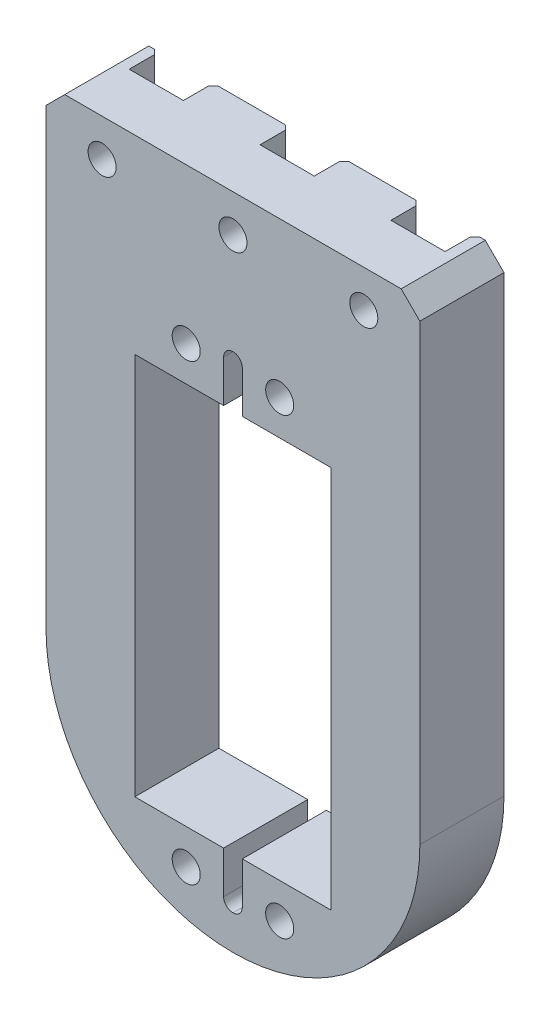
from build123d import *

# Parameters (mm, degrees)
SKETCH_1_W          = 40
SKETCH_1_H          = 70.5
EXTRUDE_1_DEPTH     = 9
CHAMFER_1_SIZE      = 2
FILLET_3_R          = 20
SKETCH_2_W          = 21
SKETCH_2_H          = 41
CUT_EXTRUDE_1_DEPTH = 10
SKETCH_3_W          = 2
SKETCH_3_H          = 5.5
CUT_EXTRUDE_2_DEPTH = 10
SKETCH_4_R          = 1.5
CUT_EXTRUDE_3_DEPTH = 10
SKETCH_5_R          = 1.5
CUT_EXTRUDE_4_DEPTH = 10
FILLET_4_R          = 1
CUT_EXTRUDE_5_DEPTH = 3.2
CHAMFER_2_SIZE      = 0.5


with BuildPart() as part:
    # 草图1 → 凸台-拉伸1 (new body)
    with BuildSketch(Plane.XY):
        with Locations((20, -34.75)):
            Rectangle(SKETCH_1_W, SKETCH_1_H)
    extrude(amount=EXTRUDE_1_DEPTH)

    # 倒角1
    chamfer_1_edges = [part.edges().sort_by_distance(p)[0] for p in [
        (0, 0.5, 4.5),
        (40, 0.5, 4.5),
    ]]
    chamfer(chamfer_1_edges, length=CHAMFER_1_SIZE)

    # 圆角3
    fillet_3_edges = [part.edges().sort_by_distance(p)[0] for p in [
        (0, -70, 4.5),
        (40, -70, 4.5),
    ]]
    fillet(fillet_3_edges, radius=FILLET_3_R - 0.0001)  # a hair under: the kernel refuses the full size

    # 草图2 → 切除-拉伸1 (cut)
    with BuildSketch(Plane(origin=(0, 0, 0), x_dir=(-1, 0, 0), z_dir=(0, 0, -1))):
        with Locations((-20, -40.32)):
            Rectangle(SKETCH_2_W, SKETCH_2_H)
    extrude(amount=-CUT_EXTRUDE_1_DEPTH, mode=Mode.SUBTRACT)

    # 草图3 → 切除-拉伸2 (cut)
    with BuildSketch(Plane.XY.offset(9)):
        with Locations((20, -17.07)):
            Rectangle(SKETCH_3_W, SKETCH_3_H)
        with Locations((20, -63.57)):
            Rectangle(SKETCH_3_W, SKETCH_3_H)
    extrude(amount=-CUT_EXTRUDE_2_DEPTH, mode=Mode.SUBTRACT)

    # 草图4 → 切除-拉伸3 (cut)
    with BuildSketch(Plane(origin=(0, 0, 0), x_dir=(-1, 0, 0), z_dir=(0, 0, -1))):
        with Locations((-25, -16.07)):
            Circle(SKETCH_4_R)
        with Locations((-15, -16.07)):
            Circle(SKETCH_4_R)
        with Locations((-25, -64.57)):
            Circle(SKETCH_4_R)
        with Locations((-15, -64.57)):
            Circle(SKETCH_4_R)
    extrude(amount=-CUT_EXTRUDE_3_DEPTH, mode=Mode.SUBTRACT)

    # 草图5 → 切除-拉伸4 (cut)
    with BuildSketch(Plane(origin=(0, 0, 0), x_dir=(-1, 0, 0), z_dir=(0, 0, -1))):
        with Locations((-34, -3.5)):
            Circle(SKETCH_5_R)
        with Locations((-20, -3.5)):
            Circle(SKETCH_5_R)
        with Locations((-6, -3.5)):
            Circle(SKETCH_5_R)
    extrude(amount=-CUT_EXTRUDE_4_DEPTH, mode=Mode.SUBTRACT)

    # 圆角4
    fillet_4_edges = [part.edges().sort_by_distance(p)[0] for p in [
        (21, -66.32, 4.5),
        (19, -66.32, 4.5),
        (21, -14.32, 4.5),
        (19, -14.32, 4.5),
    ]]
    fillet(fillet_4_edges, radius=FILLET_4_R - 0.0001)  # a hair under: the kernel refuses the full size

    # 草图7 → 切除-拉伸5 (cut)
    with BuildSketch(Plane(origin=(0, 0, 0), x_dir=(-1, 0, 0), z_dir=(0, 0, -1))):
        with BuildLine():
            Line((-36.9, -3.5), (-36.9, 0.5))
            Line((-36.9, 0.5), (-31.1, 0.5))
            Line((-31.1, 0.5), (-31.1, -3.5))
            ThreePointArc((-31.1, -3.5), (-34, -6.4), (-36.9, -3.5))
        make_face()
        with BuildLine():
            Line((-17.1, -3.5), (-17.1, 0.5))
            Line((-17.1, 0.5), (-22.9, 0.5))
            Line((-22.9, 0.5), (-22.9, -3.5))
            ThreePointArc((-22.9, -3.5), (-20, -6.4), (-17.1, -3.5))
        make_face()
        with BuildLine():
            Line((-3.1, -3.5), (-3.1, 0.5))
            Line((-3.1, 0.5), (-8.9, 0.5))
            Line((-8.9, 0.5), (-8.9, -3.5))
            ThreePointArc((-8.9, -3.5), (-6, -6.4), (-3.1, -3.5))
        make_face()
    extrude(amount=-CUT_EXTRUDE_5_DEPTH, mode=Mode.SUBTRACT)

    # 倒角2
    chamfer_2_edges = [part.edges().sort_by_distance(p)[0] for p in [
        (16.5, -16.07, 0),
        (26.5, -64.57, 0),
        (16.5, -64.57, 0),
        (26.5, -16.07, 0),
        (34, -6.4, 0),
        (31.1, -1.5, 0),
        (36.9, -1.5, 0),
        (20, -6.4, 0),
        (17.1, -1.5, 0),
        (22.9, -1.5, 0),
        (6, -6.4, 0),
        (3.1, -1.5, 0),
        (8.9, -1.5, 0),
    ]]
    chamfer(chamfer_2_edges, length=CHAMFER_2_SIZE)


solid = part.part
